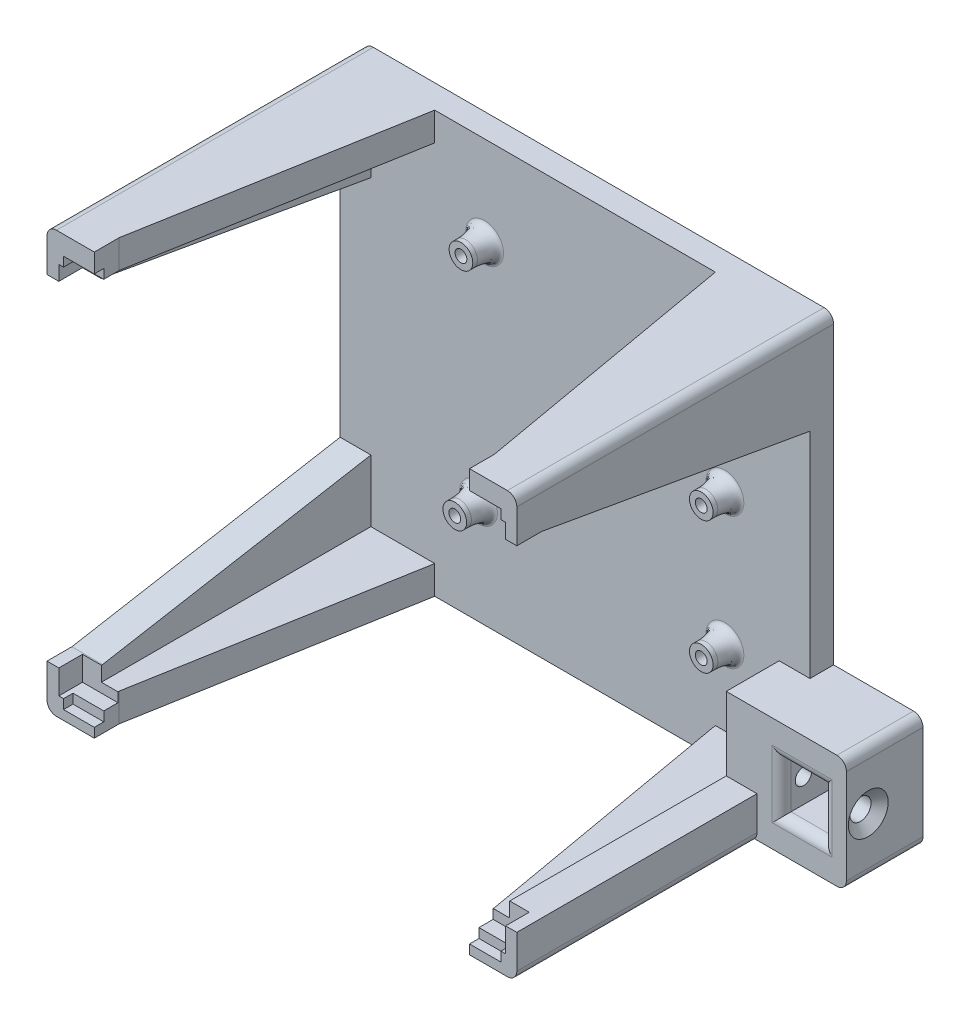
from build123d import *

# Parameters (mm, degrees)
SKETCH1_W                                         = 68.6
SKETCH1_H                                         = 53.3
BOSS_EXTRUDE1_DEPTH                               = 2
SKETCH6_W                                         = 72.6
SKETCH6_H                                         = 57.3
BOSS_EXTRUDE3_DEPTH                               = 2
SKETCH3_R                                         = 2.5
BOSS_EXTRUDE2_DEPTH                               = 5
FILLET1_SIZE                                      = 1.5
FILLET1_SIZE_2                                    = 4
SKETCH8_W                                         = 99.318004796
SKETCH8_H                                         = 89.011841234
BOSS_EXTRUDE4_DEPTH                               = 2
BOSS_EXTRUDE5_DEPTH                               = 63.969190846
CUT_EXTRUDE1_START                                = -5
SKETCH11_W                                        = 94.45
SKETCH11_H                                        = 79
CUT_EXTRUDE1_DEPTH                                = 5
SKETCH24_W                                        = 92.45
SKETCH24_H                                        = 83
CUT_EXTRUDE2_DEPTH                                = 2
CHAMFER1_SIZE                                     = 10
CHAMFER1_SIZE2                                    = 56.712818196
SKETCH12_W                                        = 18.9
SKETCH12_H                                        = 24
SKETCH12_W_2                                      = 8.7
SKETCH12_H_2                                      = 10.2
BOSS_EXTRUDE6_DEPTH                               = 13.191756426
SKETCH13_W                                        = 13.191756426
SKETCH13_H                                        = 24
BOSS_EXTRUDE7_DEPTH                               = 6.5
BOSS_EXTRUDE9_DEPTH                               = 3
FILLET2_R                                         = 2
CSK_FOR_8_FLAT_HEAD_MACHINE_SCREW_100_D           = 4.4958
CSK_FOR_8_FLAT_HEAD_MACHINE_SCREW_100_DEPTH       = 5
CSK_FOR_8_FLAT_HEAD_MACHINE_SCREW_100_CSINK_D     = 8.4328
CSK_FOR_8_FLAT_HEAD_MACHINE_SCREW_100_CSINK_ANGLE = 100
TAP_DRILL_FOR_8_32_TAP2_D                         = 3.4544
TAP_DRILL_FOR_8_32_TAP2_DEPTH                     = 11.7


with BuildPart() as part:
    # Sketch1 → Boss-Extrude1 (new body)
    with BuildSketch(Plane.XY):
        with Locations((16.907139599, -0.839393248)):
            Rectangle(SKETCH1_W, SKETCH1_H)
    extrude(amount=BOSS_EXTRUDE1_DEPTH)

    # Sketch6 → Boss-Extrude3 (add)
    with BuildSketch(Plane.XY.offset(2)):
        with Locations((16.907139599, -0.839393248)):
            Rectangle(SKETCH6_W, SKETCH6_H)
    extrude(amount=-BOSS_EXTRUDE3_DEPTH)

    # Sketch3 → Boss-Extrude2 (add)
    with BuildSketch(Plane.XY.offset(2)):
        with Locations((-2.092860401, 23.210606752)):
            Circle(SKETCH3_R)
    boss_extrude2 = extrude(amount=BOSS_EXTRUDE2_DEPTH)

    # Sketch5 → Tap Drill for M3x0.5 Tap1 (revolve, cut)
    with BuildSketch(Plane(origin=(-2.092860401, 23.210606752, 7), x_dir=(0, -1, 0), z_dir=(1, 0, 0))):
        Polygon((0, 0), (0, 10.751075774), (1.25, 10), (1.25, 0), align=None)
    tap_drill_for_m3x0_5_tap1 = revolve(axis=Axis((-2.092860401, 23.210606752, 13.35), (0, 0, -1)), mode=Mode.SUBTRACT)

    # Sketch-Pattern1: Boss-Extrude2, Tap Drill for M3x0.5 Tap1 at 3 more places
    with Locations((50.8, -48.2, 0), (-1.3, -48.2, 0), (50.8, -20.3, 0)):
        add(boss_extrude2)
        add(tap_drill_for_m3x0_5_tap1, mode=Mode.SUBTRACT)

    # Fillet1
    # a fillet whose section is not a circle: 4, 1.5 mm, written as the material it adds along each edge
    with BuildSketch(Plane(origin=(-2.092860401, 23.210606752, 2), x_dir=(1, 0, 0), z_dir=(0, -1, 0))) as fillet1_piece_1:
        with BuildLine():
            Bezier((2.5 + FILLET1_SIZE, 0), (2.5, 0), (2.5, FILLET1_SIZE_2), weights=[1, 0.707106781, 1])
            Line((2.5, FILLET1_SIZE_2), (2.5, 0))
            Line((2.5, 0), (2.5 + FILLET1_SIZE, 0))
        make_face()
    revolve(axis=Axis((-2.092860401, 23.210606752, 2), (0, 0, 1)))
    with BuildSketch(Plane(origin=(48.707139599, -24.989393248, 2), x_dir=(1, 0, 0), z_dir=(0, -1, 0))) as fillet1_piece_2:
        with BuildLine():
            Bezier((2.5 + FILLET1_SIZE, 0), (2.5, 0), (2.5, FILLET1_SIZE_2), weights=[1, 0.707106781, 1])
            Line((2.5, FILLET1_SIZE_2), (2.5, 0))
            Line((2.5, 0), (2.5 + FILLET1_SIZE, 0))
        make_face()
    revolve(axis=Axis((48.707139599, -24.989393248, 2), (0, 0, 1)))
    with BuildSketch(Plane(origin=(-3.392860401, -24.989393248, 2), x_dir=(1, 0, 0), z_dir=(0, -1, 0))) as fillet1_piece_3:
        with BuildLine():
            Bezier((2.5 + FILLET1_SIZE, 0), (2.5, 0), (2.5, FILLET1_SIZE_2), weights=[1, 0.707106781, 1])
            Line((2.5, FILLET1_SIZE_2), (2.5, 0))
            Line((2.5, 0), (2.5 + FILLET1_SIZE, 0))
        make_face()
    revolve(axis=Axis((-3.392860401, -24.989393248, 2), (0, 0, 1)))
    with BuildSketch(Plane(origin=(48.707139599, 2.910606752, 2), x_dir=(1, 0, 0), z_dir=(0, -1, 0))) as fillet1_piece_4:
        with BuildLine():
            Bezier((2.5 + FILLET1_SIZE, 0), (2.5, 0), (2.5, FILLET1_SIZE_2), weights=[1, 0.707106781, 1])
            Line((2.5, FILLET1_SIZE_2), (2.5, 0))
            Line((2.5, 0), (2.5 + FILLET1_SIZE, 0))
        make_face()
    revolve(axis=Axis((48.707139599, 2.910606752, 2), (0, 0, 1)))

    # Sketch8 → Boss-Extrude4 (add)
    with BuildSketch(Plane(origin=(0, 0, 0), x_dir=(-1, 0, 0), z_dir=(0, 0, -1))):
        with Locations((-17.025870093, -2.348885664)):
            Rectangle(SKETCH8_W, SKETCH8_H)
    extrude(amount=-BOSS_EXTRUDE4_DEPTH)

    # Sketch10 → Boss-Extrude5 (add)
    with BuildSketch(Plane(origin=(0, 0, 0), x_dir=(-1, 0, 0), z_dir=(0, 0, -1))):
        Polygon((32.633132305, -37.732150179), (26.133132305, -37.732150179), (26.133132305, -40.854806281), (22.633132305, -40.854806281), (22.633132305, -46.854806281), (32.633132305, -46.854806281), align=None)
        Polygon((-60.184872491, -40.854806281), (-60.184872491, -37.732150179), (-66.684872491, -37.732150179), (-66.684872491, -46.854806281), (-56.684872491, -46.854806281), (-56.684872491, -40.854806281), align=None)
        Polygon((-60.184872491, 33.034378852), (-60.184872491, 36.157034953), (-56.684872491, 36.157034953), (-56.684872491, 42.157034953), (-66.684872491, 42.157034953), (-66.684872491, 33.034378852), align=None)
        Polygon((22.633132305, 42.157034953), (22.633132305, 36.157034953), (26.133132305, 36.157034953), (26.133132305, 33.034378852), (32.633132305, 33.034378852), (32.633132305, 42.157034953), align=None)
    extrude(amount=-BOSS_EXTRUDE5_DEPTH)

    # Sketch11 → Cut-Extrude1 (cut)
    with BuildSketch(Plane.XY.offset(63.969190846).offset(CUT_EXTRUDE1_START)):
        with Locations((17.091867695, -3.354806281)):
            Rectangle(SKETCH11_W, SKETCH11_H)
    extrude(amount=CUT_EXTRUDE1_DEPTH, mode=Mode.SUBTRACT)

    # Sketch24 → Cut-Extrude2 (cut)
    with BuildSketch(Plane.XY.offset(63.969190846)):
        with Locations((17.091867695, -3.354806281)):
            Rectangle(SKETCH24_W, SKETCH24_H)
    extrude(amount=-CUT_EXTRUDE2_DEPTH, mode=Mode.SUBTRACT)

    # Chamfer1
    chamfer1_edges = [part.edges().sort_by_distance(p)[0] for p in [
        (-22.633132305, -43.854806281, 2),
        (-29.383132305, -37.732150179, 2),
        (56.684872491, -43.854806281, 2),
        (56.684872491, 39.157034953, 2),
        (63.434872491, 33.034378852, 2),
        (-29.383132305, 33.034378852, 2),
        (-22.633132305, 39.157034953, 2),
    ]]
    chamfer1_side = [part.faces().sort_by_distance(p)[0] for p in [
        (16.881899633, -2.261494337, 2),
    ]]
    chamfer(chamfer1_edges, length=CHAMFER1_SIZE, length2=CHAMFER1_SIZE2, reference=chamfer1_side[0])

    # Sketch12 → Boss-Extrude6 (add)
    with BuildSketch(Plane(origin=(0, 0, 0), x_dir=(-1, 0, 0), z_dir=(0, 0, -1))):
        with Locations((-76.134872491, -34.251019974)):
            Rectangle(SKETCH12_W, SKETCH12_H)
        with Locations((-76.234872491, -34.351019974)):
            Rectangle(SKETCH12_W_2, SKETCH12_H_2, mode=Mode.SUBTRACT)
    extrude(amount=-BOSS_EXTRUDE6_DEPTH)

    # Sketch13 → Boss-Extrude7 (add)
    with BuildSketch(Plane.ZY.offset(-66.684872491)):
        with Locations((6.595878213, -34.251019974)):
            Rectangle(SKETCH13_W, SKETCH13_H)
    extrude(amount=BOSS_EXTRUDE7_DEPTH)

    # Sketch17 → Boss-Extrude9 (add)
    with BuildSketch(Plane(origin=(0, 0, 0), x_dir=(-1, 0, 0), z_dir=(0, 0, -1))):
        Polygon((-66.684872491, 42.157034953), (-66.684872491, -22.251019974), (-85.584872491, -22.251019974), (-85.584872491, -46.251019974), (-66.684872491, -46.251019974), (-66.684872491, -46.854806281), (32.633132305, -46.854806281), (32.633132305, 42.157034953), align=None)
    extrude(amount=BOSS_EXTRUDE9_DEPTH)

    # Fillet2
    # the kernel refuses this fillet: 2 mm, written as the material it takes off along each edge
    with BuildSketch(Plane(origin=(85.584872491, -22.251019974, 18.191756426), x_dir=(0, -1, 0), z_dir=(0, 0, -1))) as fillet2_piece_1:
        with BuildLine():
            CenterArc((FILLET2_R, FILLET2_R), FILLET2_R, 180, 90)
            Line((0, FILLET2_R), (0, 0))
            Line((0, 0), (FILLET2_R, 0))
        make_face()
    extrude(amount=26.191756426, mode=Mode.SUBTRACT)
    with BuildSketch(Plane(origin=(85.584872491, -46.251019974, 18.191756426), x_dir=(0, 1, 0), z_dir=(0, 0, -1))) as fillet2_piece_2:
        with BuildLine():
            CenterArc((FILLET2_R, -FILLET2_R), FILLET2_R, 90, 90)
            Line((0, -FILLET2_R), (0, 0))
            Line((0, 0), (FILLET2_R, 0))
        make_face()
    extrude(amount=26.191756426, mode=Mode.SUBTRACT)
    with BuildSketch(Plane(origin=(66.684872491, -46.854806281, 68.969190846), x_dir=(0, 1, 0), z_dir=(0, 0, -1))) as fillet2_piece_3_section:
        with BuildLine():
            CenterArc((FILLET2_R, -FILLET2_R), FILLET2_R, 90, 90)
            Line((0, -FILLET2_R), (0, 0))
            Line((0, 0), (FILLET2_R, 0))
        make_face()
    fillet2_piece_3 = extrude(amount=76.969190846, mode=Mode.PRIVATE)
    fillet2_piece_3 = split(fillet2_piece_3, bisect_by=Plane(origin=(66.684872491, -46.854806281, 13.191756426), z_dir=(0, 0, 1)), keep=Keep.TOP, mode=Mode.PRIVATE)
    fillet2_piece_3 = split(fillet2_piece_3, bisect_by=Plane(origin=(66.684872491, -46.251019974, 68.969190846), z_dir=(0, 1, 0)), keep=Keep.TOP, mode=Mode.PRIVATE)
    add(fillet2_piece_3, mode=Mode.SUBTRACT)
    with BuildSketch(Plane(origin=(66.684872491, -46.854806281, 68.969190846), x_dir=(0, 1, 0), z_dir=(0, 0, -1))) as fillet2_piece_4_section:
        with BuildLine():
            CenterArc((FILLET2_R, -FILLET2_R), FILLET2_R, 90, 90)
            Line((0, -FILLET2_R), (0, 0))
            Line((0, 0), (FILLET2_R, 0))
        make_face()
    fillet2_piece_4 = extrude(amount=76.969190846, mode=Mode.PRIVATE)
    fillet2_piece_4 = split(fillet2_piece_4, bisect_by=Plane(origin=(66.684872491, -46.854806281, 13.191756426), z_dir=(0, 0, 1)), keep=Keep.TOP, mode=Mode.PRIVATE)
    fillet2_piece_4 = split(fillet2_piece_4, bisect_by=Plane(origin=(66.684872491, -46.251019974, 68.969190846), z_dir=(0, -1, 0)), keep=Keep.TOP, mode=Mode.PRIVATE)
    add(fillet2_piece_4, mode=Mode.SUBTRACT)
    with BuildSketch(Plane(origin=(66.684872491, -46.854806281, 68.969190846), x_dir=(0, 1, 0), z_dir=(0, 0, -1))) as fillet2_piece_5_section:
        with BuildLine():
            CenterArc((FILLET2_R, -FILLET2_R), FILLET2_R, 90, 90)
            Line((0, -FILLET2_R), (0, 0))
            Line((0, 0), (FILLET2_R, 0))
        make_face()
    fillet2_piece_5 = extrude(amount=76.969190846, mode=Mode.PRIVATE)
    fillet2_piece_5 = split(fillet2_piece_5, bisect_by=Plane(origin=(66.684872491, -46.854806281, 13.191756426), z_dir=(0, 0, -1)), keep=Keep.TOP, mode=Mode.PRIVATE)
    fillet2_piece_5 = split(fillet2_piece_5, bisect_by=Plane(origin=(66.684872491, -46.251019974, 68.969190846), z_dir=(0, -1, 0)), keep=Keep.TOP, mode=Mode.PRIVATE)
    add(fillet2_piece_5, mode=Mode.SUBTRACT)
    with BuildSketch(Plane(origin=(66.684872491, 42.157034953, -8), x_dir=(-1, 0, 0), z_dir=(0, 0, 1)), Plane(origin=(-32.633132305, 42.157034953, -8), x_dir=(0, -1, 0), z_dir=(0, 0, 1)), Plane(origin=(-32.633132305, -46.854806281, -8), x_dir=(1, 0, 0), z_dir=(0, 0, 1))) as fillet2_piece_6:
        with BuildLine():
            CenterArc((FILLET2_R, FILLET2_R), FILLET2_R, 180, 90)
            Line((0, FILLET2_R), (0, 0))
            Line((0, 0), (FILLET2_R, 0))
        make_face()
    extrude(amount=76.969190846, mode=Mode.SUBTRACT)
    with BuildSketch(Plane(origin=(80.584872491, -29.251019974, 13.191756426), x_dir=(1.0, 0, 1.0532108518646055e-10), z_dir=(0, -1, 0)), Plane(origin=(71.884872491, -39.451019974, 13.191756426), x_dir=(-1.0, 0, 1.0532108518646055e-10), z_dir=(0, 1, 0))) as fillet2_piece_7:
        with BuildLine():
            CenterArc((FILLET2_R, -FILLET2_R), FILLET2_R, 89.999999994, 90)
            Line((-FILLET2_R * 1.05321085175e-10, -FILLET2_R), (0, 0))
            Line((0, 0), (FILLET2_R, 0))
        make_face()
    extrude(amount=10.2, mode=Mode.SUBTRACT)
    with BuildSketch(Plane(origin=(80.584872491, -39.451019974, 13.191756426), x_dir=(0, -1.0, 1.0532108518646055e-10), z_dir=(-1, 0, 0)), Plane(origin=(71.884872491, -29.251019974, 13.191756426), x_dir=(0, 1.0, 1.0532108518646055e-10), z_dir=(1, 0, 0))) as fillet2_piece_8:
        with BuildLine():
            CenterArc((FILLET2_R, -FILLET2_R), FILLET2_R, 89.999999994, 90)
            Line((-FILLET2_R * 1.05321085175e-10, -FILLET2_R), (0, 0))
            Line((0, 0), (FILLET2_R, 0))
        make_face()
    extrude(amount=8.7, mode=Mode.SUBTRACT)
    with BuildSketch(Plane(origin=(80.584872491, -24.251019974, 13.191756426), x_dir=(1.0, 0, 1.0532108518646055e-10), z_dir=(0, -1, 0))) as fillet2_piece_9a_section:
        with BuildLine():
            CenterArc((FILLET2_R, -FILLET2_R), FILLET2_R, 89.999999994, 90)
            Line((-FILLET2_R * 1.05321085175e-10, -FILLET2_R), (0, 0))
            Line((0, 0), (FILLET2_R, 0))
        make_face()
    fillet2_piece_9a = extrude(amount=15.2, mode=Mode.PRIVATE)
    fillet2_piece_9a = split(fillet2_piece_9a, bisect_by=Plane(origin=(80.584872491, -29.251019974, 13.191756426), z_dir=(0, 1, 0)), keep=Keep.TOP, mode=Mode.PRIVATE)
    with BuildSketch(Plane(origin=(71.884872491, -29.251019974, 13.191756426), x_dir=(0, 1.0, 1.0532108518646055e-10), z_dir=(1, 0, 0))) as fillet2_piece_9b_section:
        with BuildLine():
            CenterArc((FILLET2_R, -FILLET2_R), FILLET2_R, 89.999999994, 90)
            Line((-FILLET2_R * 1.05321085175e-10, -FILLET2_R), (0, 0))
            Line((0, 0), (FILLET2_R, 0))
        make_face()
    fillet2_piece_9b = extrude(amount=13.7, mode=Mode.PRIVATE)
    fillet2_piece_9b = split(fillet2_piece_9b, bisect_by=Plane(origin=(80.584872491, -29.251019974, 13.191756426), z_dir=(1, 0, 0)), keep=Keep.TOP, mode=Mode.PRIVATE)
    fillet2_piece_9 = fillet2_piece_9a & fillet2_piece_9b
    add(fillet2_piece_9, mode=Mode.SUBTRACT)
    with BuildSketch(Plane(origin=(80.584872491, -29.251019974, 13.191756426), x_dir=(1.0, 0, 1.0532108518646055e-10), z_dir=(0, -1, 0))) as fillet2_piece_10a_section:
        with BuildLine():
            CenterArc((FILLET2_R, -FILLET2_R), FILLET2_R, 89.999999994, 90)
            Line((-FILLET2_R * 1.05321085175e-10, -FILLET2_R), (0, 0))
            Line((0, 0), (FILLET2_R, 0))
        make_face()
    fillet2_piece_10a = extrude(amount=15.2, mode=Mode.PRIVATE)
    fillet2_piece_10a = split(fillet2_piece_10a, bisect_by=Plane(origin=(80.584872491, -39.451019974, 13.191756426), z_dir=(0, -1, 0)), keep=Keep.TOP, mode=Mode.PRIVATE)
    with BuildSketch(Plane(origin=(85.584872491, -39.451019974, 13.191756426), x_dir=(0, -1.0, 1.0532108518646055e-10), z_dir=(-1, 0, 0))) as fillet2_piece_10b_section:
        with BuildLine():
            CenterArc((FILLET2_R, -FILLET2_R), FILLET2_R, 89.999999994, 90)
            Line((-FILLET2_R * 1.05321085175e-10, -FILLET2_R), (0, 0))
            Line((0, 0), (FILLET2_R, 0))
        make_face()
    fillet2_piece_10b = extrude(amount=13.7, mode=Mode.PRIVATE)
    fillet2_piece_10b = split(fillet2_piece_10b, bisect_by=Plane(origin=(80.584872491, -39.451019974, 13.191756426), z_dir=(1, 0, 0)), keep=Keep.TOP, mode=Mode.PRIVATE)
    fillet2_piece_10 = fillet2_piece_10a & fillet2_piece_10b
    add(fillet2_piece_10, mode=Mode.SUBTRACT)
    with BuildSketch(Plane(origin=(71.884872491, -44.451019974, 13.191756426), x_dir=(-1.0, 0, 1.0532108518646055e-10), z_dir=(0, 1, 0))) as fillet2_piece_11a_section:
        with BuildLine():
            CenterArc((FILLET2_R, -FILLET2_R), FILLET2_R, 89.999999994, 90)
            Line((-FILLET2_R * 1.05321085175e-10, -FILLET2_R), (0, 0))
            Line((0, 0), (FILLET2_R, 0))
        make_face()
    fillet2_piece_11a = extrude(amount=15.2, mode=Mode.PRIVATE)
    fillet2_piece_11a = split(fillet2_piece_11a, bisect_by=Plane(origin=(71.884872491, -39.451019974, 13.191756426), z_dir=(0, -1, 0)), keep=Keep.TOP, mode=Mode.PRIVATE)
    with BuildSketch(Plane(origin=(80.584872491, -39.451019974, 13.191756426), x_dir=(0, -1.0, 1.0532108518646055e-10), z_dir=(-1, 0, 0))) as fillet2_piece_11b_section:
        with BuildLine():
            CenterArc((FILLET2_R, -FILLET2_R), FILLET2_R, 89.999999994, 90)
            Line((-FILLET2_R * 1.05321085175e-10, -FILLET2_R), (0, 0))
            Line((0, 0), (FILLET2_R, 0))
        make_face()
    fillet2_piece_11b = extrude(amount=13.7, mode=Mode.PRIVATE)
    fillet2_piece_11b = split(fillet2_piece_11b, bisect_by=Plane(origin=(71.884872491, -39.451019974, 13.191756426), z_dir=(-1, 0, 0)), keep=Keep.TOP, mode=Mode.PRIVATE)
    fillet2_piece_11 = fillet2_piece_11a & fillet2_piece_11b
    add(fillet2_piece_11, mode=Mode.SUBTRACT)
    with BuildSketch(Plane(origin=(66.884872491, -29.251019974, 13.191756426), x_dir=(0, 1.0, 1.0532108518646055e-10), z_dir=(1, 0, 0))) as fillet2_piece_12a_section:
        with BuildLine():
            CenterArc((FILLET2_R, -FILLET2_R), FILLET2_R, 89.999999994, 90)
            Line((-FILLET2_R * 1.05321085175e-10, -FILLET2_R), (0, 0))
            Line((0, 0), (FILLET2_R, 0))
        make_face()
    fillet2_piece_12a = extrude(amount=13.7, mode=Mode.PRIVATE)
    fillet2_piece_12a = split(fillet2_piece_12a, bisect_by=Plane(origin=(71.884872491, -29.251019974, 13.191756426), z_dir=(-1, 0, 0)), keep=Keep.TOP, mode=Mode.PRIVATE)
    with BuildSketch(Plane(origin=(71.884872491, -39.451019974, 13.191756426), x_dir=(-1.0, 0, 1.0532108518646055e-10), z_dir=(0, 1, 0))) as fillet2_piece_12b_section:
        with BuildLine():
            CenterArc((FILLET2_R, -FILLET2_R), FILLET2_R, 89.999999994, 90)
            Line((-FILLET2_R * 1.05321085175e-10, -FILLET2_R), (0, 0))
            Line((0, 0), (FILLET2_R, 0))
        make_face()
    fillet2_piece_12b = extrude(amount=15.2, mode=Mode.PRIVATE)
    fillet2_piece_12b = split(fillet2_piece_12b, bisect_by=Plane(origin=(71.884872491, -29.251019974, 13.191756426), z_dir=(0, 1, 0)), keep=Keep.TOP, mode=Mode.PRIVATE)
    fillet2_piece_12 = fillet2_piece_12a & fillet2_piece_12b
    add(fillet2_piece_12, mode=Mode.SUBTRACT)

    # CSK for #8 Flat Head Machine Screw (100)1
    with Locations(Plane(origin=(85.584872491, 0, 0), x_dir=(0, 0, -1), z_dir=(1, 0, 0))):
        with Locations((-8.571756426, -34.251019974)):
            CounterSinkHole(CSK_FOR_8_FLAT_HEAD_MACHINE_SCREW_100_D / 2, CSK_FOR_8_FLAT_HEAD_MACHINE_SCREW_100_CSINK_D / 2, depth=CSK_FOR_8_FLAT_HEAD_MACHINE_SCREW_100_DEPTH, counter_sink_angle=CSK_FOR_8_FLAT_HEAD_MACHINE_SCREW_100_CSINK_ANGLE)

    # Tap Drill for #8-32 Tap2
    with Locations(Plane.ZY.offset(-60.184872491)):
        with Locations((8.571756426, -34.251019974)):
            Hole(TAP_DRILL_FOR_8_32_TAP2_D / 2, depth=TAP_DRILL_FOR_8_32_TAP2_DEPTH)


solid = part.part
